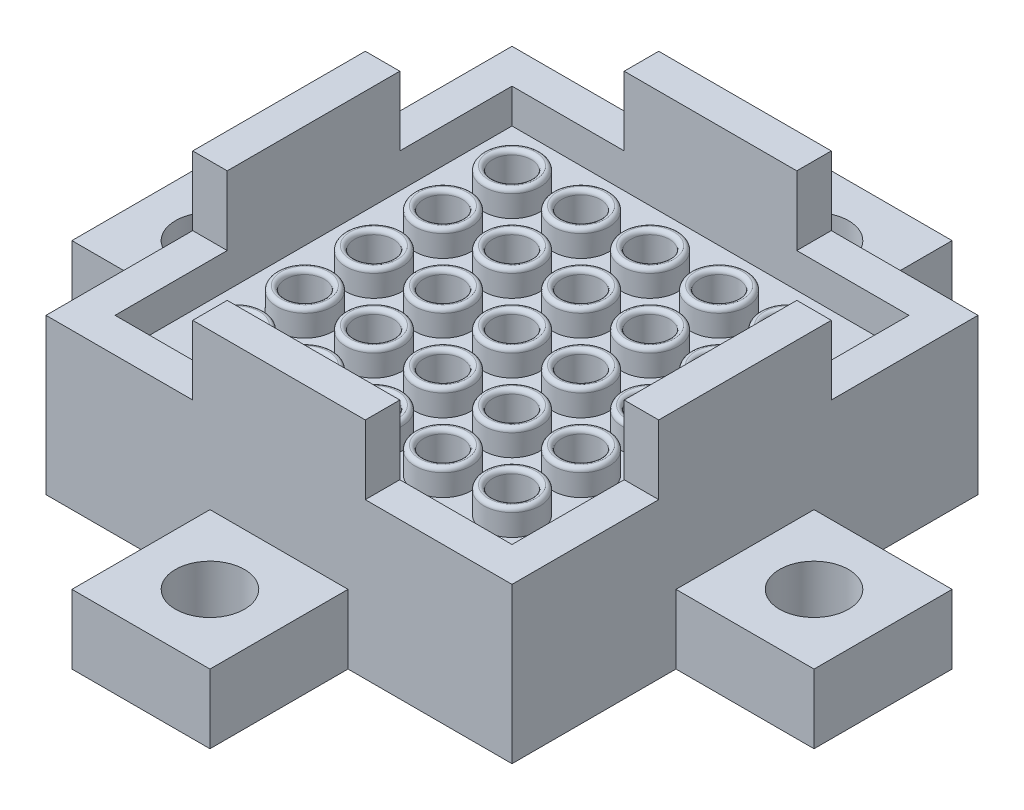
from build123d import *

# Parameters (mm, degrees)
SKETCH1_W              = 27
SKETCH1_H              = 27
SKETCH1_W_2            = 23
SKETCH1_H_2            = 23
BOSS_EXTRUDE1_DEPTH    = 2
SKETCH2_W              = 27
SKETCH2_H              = 27
BOSS_EXTRUDE2_DEPTH    = 2
SKETCH3_W              = 27
SKETCH3_H              = 27
SKETCH3_W_2            = 23
SKETCH3_H_2            = 23
BOSS_EXTRUDE3_DEPTH    = 3
SKETCH6_R              = 1.625
BOSS_EXTRUDE5_DEPTH    = 1.5
CUT_EXTRUDE2_REACH     = 22.168
SKETCH7_R              = 1.125
FILLET1_R              = 0.25
LPATTERN3_COUNT        = 5
LPATTERN3_PITCH        = 4
LPATTERN3_COUNT_DIR2   = 5
LPATTERN3_PITCH_DIR2   = 4
FILLET1_OF_LPATTERN3_R = 0.25
SKETCH11_R             = 0.75
BOSS_EXTRUDE8_DEPTH    = 3
LPATTERN2_COUNT        = 6
LPATTERN2_PITCH        = 4
LPATTERN2_COUNT_DIR2   = 6
LPATTERN2_PITCH_DIR2   = 4
SKETCH14_R             = 2.969848481
BOSS_EXTRUDE10_DEPTH   = 0.5
SKETCH8_W              = 27
SKETCH8_H              = 27
BOSS_EXTRUDE6_DEPTH    = 2
SKETCH9_R              = 4.25
CUT_EXTRUDE3_DEPTH     = 3
SKETCH10_W             = 2
SKETCH10_H             = 10
BOSS_EXTRUDE7_DEPTH    = 4
CIRPATTERN2_COUNT      = 4
SKETCH12_W             = 8
SKETCH12_H             = 4
BOSS_EXTRUDE9_DEPTH    = 8
CIRPATTERN1_COUNT      = 4
CUT_EXTRUDE4_REACH     = 33.71
SKETCH16_R             = 2
CIRPATTERN3_COUNT      = 4
SKETCH15_R             = 0.75
BOSS_EXTRUDE11_DEPTH   = 3


with BuildPart() as part:
    # Sketch1 → Boss-Extrude1 (new body)
    with BuildSketch(Plane(origin=(0, 0, 0), x_dir=(1, 0, 0), z_dir=(0, 1, 0))):
        Rectangle(SKETCH1_W, SKETCH1_H)
        Rectangle(SKETCH1_W_2, SKETCH1_H_2, mode=Mode.SUBTRACT)
    extrude(amount=BOSS_EXTRUDE1_DEPTH)

    # Sketch2 → Boss-Extrude2 (add)
    with BuildSketch(Plane.XZ):
        Rectangle(SKETCH2_W, SKETCH2_H)
    extrude(amount=BOSS_EXTRUDE2_DEPTH)

    # Sketch3 → Boss-Extrude3 (add)
    with BuildSketch(Plane.XZ.offset(2)):
        Rectangle(SKETCH3_W, SKETCH3_H)
        Rectangle(SKETCH3_W_2, SKETCH3_H_2, mode=Mode.SUBTRACT)
    extrude(amount=BOSS_EXTRUDE3_DEPTH)

    # Sketch6 → Boss-Extrude5 (add)
    with BuildSketch(Plane(origin=(0, 0, 0), x_dir=(1, 0, 0), z_dir=(0, 1, 0))):
        with Locations(Location((8, 8, 0), (0, 0, 90))):
            Circle(SKETCH6_R)
    boss_extrude5 = extrude(amount=BOSS_EXTRUDE5_DEPTH)

    # Sketch7 → Cut-Extrude2 (cut, up to next)
    with BuildSketch(Plane(origin=(0, 1.5, 0), x_dir=(1, 0, 0), z_dir=(0, 1, 0)), mode=Mode.PRIVATE) as cut_extrude2_sk1:
        with Locations(Location((8, 8, 0), (0, 0, 270))):
            Circle(SKETCH7_R)
    cut_extrude2_tool1 = extrude(cut_extrude2_sk1.sketch, amount=-CUT_EXTRUDE2_REACH, mode=Mode.PRIVATE) & part.part
    cut_extrude2 = cut_extrude2_tool1.solids().sort_by_distance((8, 1.5, -8))[0]
    add(cut_extrude2, mode=Mode.SUBTRACT)

    # Fillet1
    fillet1_edges = [part.edges().sort_by_distance(p)[0] for p in [
        (8, 1.5, -6.375),
        (8, 1.5, -9.125),
    ]]
    fillet(fillet1_edges, radius=FILLET1_R - 0.0001)  # a hair under: the kernel refuses the full size

    # LPattern3: Boss-Extrude5, Cut-Extrude2 5 × 5
    with Locations(*[(-j * LPATTERN3_PITCH_DIR2, 0, i * LPATTERN3_PITCH) for i in range(LPATTERN3_COUNT) for j in range(LPATTERN3_COUNT_DIR2) if (i, j) != (0, 0)]):
        add(boss_extrude5)
        add(cut_extrude2, mode=Mode.SUBTRACT)

    # Fillet1 of LPattern3
    fillet1_of_lpattern3_edges = [part.edges().sort_by_distance(p)[0] for p in [
        (4, 1.5, -6.375),
        (4, 1.5, -9.125),
        (0, 1.5, -6.375),
        (0, 1.5, -9.125),
        (-4, 1.5, -6.375),
        (-4, 1.5, -9.125),
        (-8, 1.5, -6.375),
        (-8, 1.5, -9.125),
        (8, 1.5, -2.375),
        (8, 1.5, -5.125),
        (4, 1.5, -2.375),
        (4, 1.5, -5.125),
        (0, 1.5, -2.375),
        (0, 1.5, -5.125),
        (-4, 1.5, -2.375),
        (-4, 1.5, -5.125),
        (-8, 1.5, -2.375),
        (-8, 1.5, -5.125),
        (8, 1.5, 1.625),
        (8, 1.5, -1.125),
        (4, 1.5, 1.625),
        (4, 1.5, -1.125),
        (0, 1.5, 1.625),
        (0, 1.5, -1.125),
        (-4, 1.5, 1.625),
        (-4, 1.5, -1.125),
        (-8, 1.5, 1.625),
        (-8, 1.5, -1.125),
        (8, 1.5, 5.625),
        (8, 1.5, 2.875),
        (4, 1.5, 5.625),
        (4, 1.5, 2.875),
        (0, 1.5, 5.625),
        (0, 1.5, 2.875),
        (-4, 1.5, 5.625),
        (-4, 1.5, 2.875),
        (-8, 1.5, 5.625),
        (-8, 1.5, 2.875),
        (8, 1.5, 9.625),
        (8, 1.5, 6.875),
        (4, 1.5, 9.625),
        (4, 1.5, 6.875),
        (0, 1.5, 9.625),
        (0, 1.5, 6.875),
        (-4, 1.5, 9.625),
        (-4, 1.5, 6.875),
        (-8, 1.5, 9.625),
        (-8, 1.5, 6.875),
    ]]
    fillet(fillet1_of_lpattern3_edges, radius=FILLET1_OF_LPATTERN3_R - 0.0001)  # a hair under: the kernel refuses the full size

    # Sketch11 → Boss-Extrude8 (add)
    with BuildSketch(Plane.XZ.offset(2)):
        with Locations(Location((-9.9, 9.9, 0), (0, 0, 90))):
            Circle(SKETCH11_R)
    boss_extrude8 = extrude(amount=BOSS_EXTRUDE8_DEPTH)

    # LPattern2: Boss-Extrude8 6 × 6
    with Locations(*[(i * LPATTERN2_PITCH, 0, -j * LPATTERN2_PITCH_DIR2) for i in range(LPATTERN2_COUNT) for j in range(LPATTERN2_COUNT_DIR2) if (i, j) != (0, 0)]):
        add(boss_extrude8)

    # Sketch14 → Boss-Extrude10 (add)
    with BuildSketch(Plane(origin=(0, -3.5, 0), x_dir=(-1, 0, 0), z_dir=(0, -1, 0))):
        Circle(SKETCH14_R)
    extrude(amount=-BOSS_EXTRUDE10_DEPTH)

    # Sketch8 → Boss-Extrude6 (add)
    with BuildSketch(Plane.XZ.offset(5)):
        Rectangle(SKETCH8_W, SKETCH8_H)
    extrude(amount=BOSS_EXTRUDE6_DEPTH)

    # Sketch9 → Cut-Extrude3 (cut)
    with BuildSketch(Plane.XZ.offset(7)):
        with Locations(Location((0, 0, 0), (0, 0, 270))):
            Circle(SKETCH9_R)
    extrude(amount=-CUT_EXTRUDE3_DEPTH, mode=Mode.SUBTRACT)

    # Sketch10 → Boss-Extrude7 (add)
    with BuildSketch(Plane(origin=(0, 2, 0), x_dir=(1, 0, 0), z_dir=(0, 1, 0))):
        with Locations((-12.5, 0)):
            Rectangle(SKETCH10_W, SKETCH10_H)
    boss_extrude7 = extrude(amount=BOSS_EXTRUDE7_DEPTH)

    # CirPattern2: Boss-Extrude7 ×4 about axis
    cirpattern2_axis = Axis((0, 0, 0), (0, 1, 0))
    for i in range(1, CIRPATTERN2_COUNT):
        add(boss_extrude7.rotate(cirpattern2_axis, i * 360 / CIRPATTERN2_COUNT))

    # Sketch12 → Boss-Extrude9 (add)
    with BuildSketch(Plane.ZY.offset(13.5)):
        with Locations((0, -5)):
            Rectangle(SKETCH12_W, SKETCH12_H)
    boss_extrude9 = extrude(amount=BOSS_EXTRUDE9_DEPTH)

    # CirPattern1: Boss-Extrude9 ×4 about axis
    cirpattern1_axis = Axis((0, 0, 0), (0, 1, 0))
    for i in range(1, CIRPATTERN1_COUNT):
        add(boss_extrude9.rotate(cirpattern1_axis, i * 360 / CIRPATTERN1_COUNT))

    # Sketch16 → Cut-Extrude4 (cut, up to next)
    with BuildSketch(Plane(origin=(0, -3, 0), x_dir=(1, 0, 0), z_dir=(0, 1, 0)), mode=Mode.PRIVATE) as cut_extrude4_sk1:
        with Locations(Location((0, -17.5, 0), (0, 0, 180))):
            Circle(SKETCH16_R)
    cut_extrude4_tool1 = extrude(cut_extrude4_sk1.sketch, amount=-CUT_EXTRUDE4_REACH, mode=Mode.PRIVATE) & part.part
    cut_extrude4 = cut_extrude4_tool1.solids().sort_by_distance((0, -3, 17.5))[0]
    add(cut_extrude4, mode=Mode.SUBTRACT)

    # CirPattern3: Cut-Extrude4 ×4 about axis
    cirpattern3_axis = Axis((0, 0, 0), (0, 1, 0))
    for i in range(1, CIRPATTERN3_COUNT):
        add(cut_extrude4.rotate(cirpattern3_axis, i * 360 / CIRPATTERN3_COUNT), mode=Mode.SUBTRACT)

    # Sketch15 → Boss-Extrude11 (add)
    with BuildSketch(Plane.XZ.offset(4)):
        with Locations(Location((2.1, 1.9, 0), (0, 0, 90))):
            Circle(SKETCH15_R)
        with Locations(Location((-1.9, -2.1, 0), (0, 0, 90))):
            Circle(SKETCH15_R)
        with Locations(Location((2.1, -2.1, 0), (0, 0, 90))):
            Circle(SKETCH15_R)
        with Locations(Location((-1.9, 1.9, 0), (0, 0, 90))):
            Circle(SKETCH15_R)
    extrude(amount=BOSS_EXTRUDE11_DEPTH)


solid = part.part
